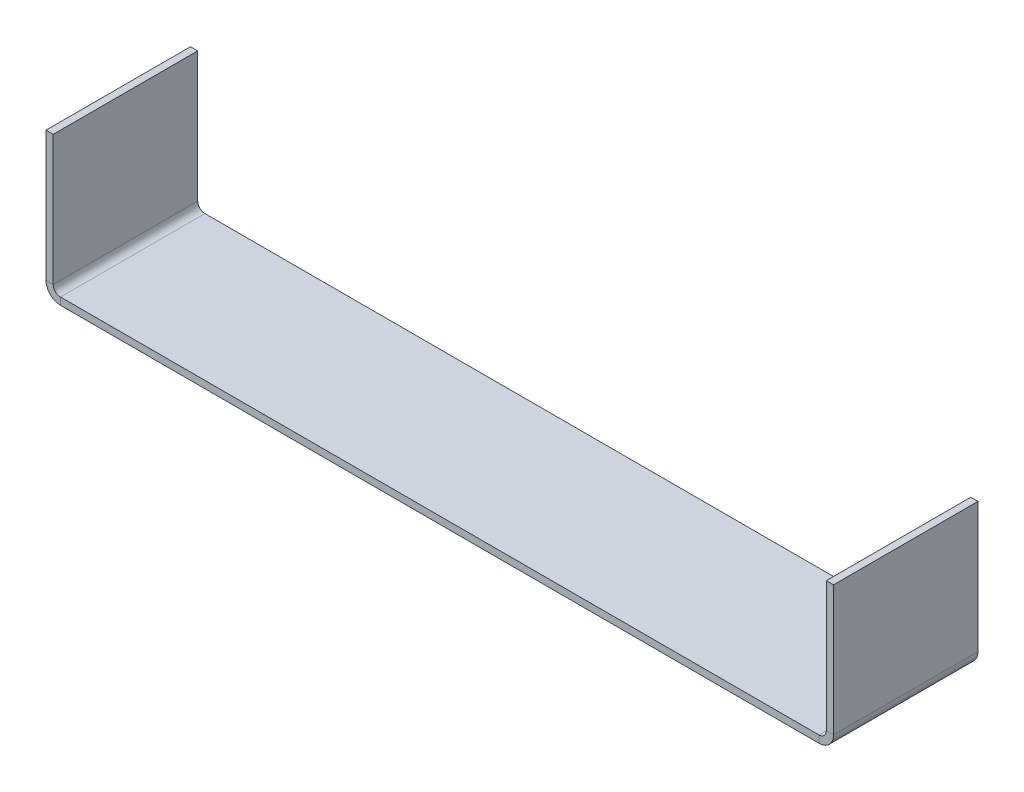
from build123d import *

# Parameters (mm, degrees)
SKETCH_1_W                       = 218
SKETCH_1_H                       = 40
EXTRUDE_1_DEPTH                  = 2
SM_EDGE_FLANGE_1_STRIP_W         = 12
SM_EDGE_FLANGE_1_STRIP_H         = 2
SM_EDGE_FLANGE_1_STRIP_CUT_DEPTH = 40
SM_EDGE_FLANGE_1_DEPTH           = 40
SM_EDGE_FLANGE_2_STRIP_W         = 12
SM_EDGE_FLANGE_2_STRIP_H         = 2
SM_EDGE_FLANGE_2_STRIP_CUT_DEPTH = 40
SM_EDGE_FLANGE_2_DEPTH           = 40


# Sheet-metal steps are written as plain solids
with BuildPart() as part:
    # Sketch 1 → Бобышка-Вытянуть1 (new body)
    with BuildSketch(Plane(origin=(0, 0, 0), x_dir=(1, 0, 0), z_dir=(0, 1, 0))):
        with Locations((109, 20)):
            Rectangle(SKETCH_1_W, SKETCH_1_H)
    extrude(amount=EXTRUDE_1_DEPTH)

    # Ребро-кромка1 strip (across the edge) → Ребро-кромка1 strip cut (cut)
    with BuildSketch(Plane(origin=(0, 2, -40), x_dir=(1, 0, 0), z_dir=(0, 0, 1))):
        with Locations((-2, -1)):
            Rectangle(SM_EDGE_FLANGE_1_STRIP_W, SM_EDGE_FLANGE_1_STRIP_H)
    extrude(amount=SM_EDGE_FLANGE_1_STRIP_CUT_DEPTH, mode=Mode.SUBTRACT)

    # Ребро-кромка1 section (across the edge) → Ребро-кромка1 (add)
    with BuildSketch(Plane(origin=(0, 2, -40), x_dir=(1, 0, 0), z_dir=(0, 0, 1))):
        with BuildLine():
            Line((0, 2), (0, 38))
            Line((0, 38), (2, 38))
            Line((2, 38), (2, 2))
            ThreePointArc((2, 2), (2.585786438, 0.585786438), (4, 0))
            Line((4, 0), (4, -2))
            ThreePointArc((4, -2), (1.171572875, -0.828427125), (0, 2))
        make_face()
    extrude(amount=SM_EDGE_FLANGE_1_DEPTH)

    # Ребро-кромка2 strip (across the edge) → Ребро-кромка2 strip cut (cut)
    with BuildSketch(Plane(origin=(218, 2, 0), x_dir=(-1, 0, 0), z_dir=(0, 0, -1))):
        with Locations((-2, -1)):
            Rectangle(SM_EDGE_FLANGE_2_STRIP_W, SM_EDGE_FLANGE_2_STRIP_H)
    extrude(amount=SM_EDGE_FLANGE_2_STRIP_CUT_DEPTH, mode=Mode.SUBTRACT)

    # Ребро-кромка2 section (across the edge) → Ребро-кромка2 (add)
    with BuildSketch(Plane(origin=(218, 2, 0), x_dir=(-1, 0, 0), z_dir=(0, 0, -1))):
        with BuildLine():
            Line((0, 2), (0, 38))
            Line((0, 38), (2, 38))
            Line((2, 38), (2, 2))
            ThreePointArc((2, 2), (2.585786438, 0.585786438), (4, 0))
            Line((4, 0), (4, -2))
            ThreePointArc((4, -2), (1.171572875, -0.828427125), (0, 2))
        make_face()
    extrude(amount=SM_EDGE_FLANGE_2_DEPTH)


solid = part.part
